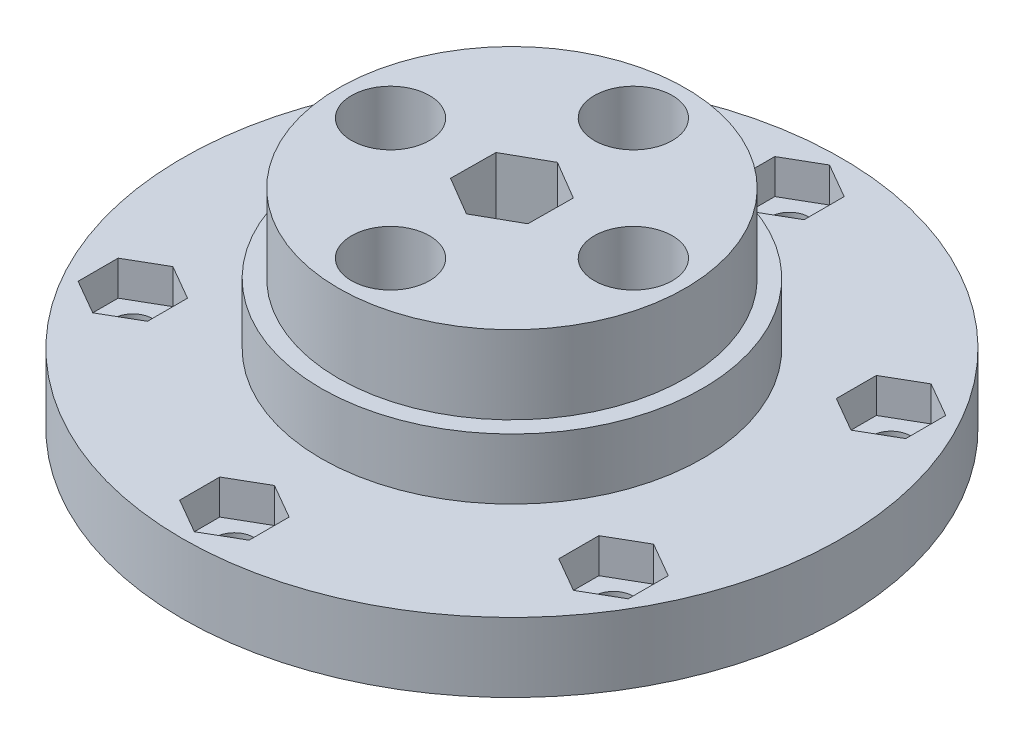
from build123d import *

# Parameters (mm, degrees)
SKETCH_1_R          = 38
EXTRUDE_1_DEPTH     = 8
SKETCH_2_R          = 20
EXTRUDE_2_DEPTH     = 16
SKETCH_7_R          = 22
EXTRUDE_3_DEPTH     = 7
SKETCH_3_R          = 4.5
SKETCH_3_R_2        = 3.25
CUT_EXTRUDE_1_DEPTH = 59.855755878
CUT_EXTRUDE_2_DEPTH = 12
SKETCH_5_R          = 2.25
CUT_EXTRUDE_3_DEPTH = 59.855755878
CUT_EXTRUDE_4_DEPTH = 4


with BuildPart() as part:
    # Эскиз1 → Бобышка-Вытянуть1 (new body)
    with BuildSketch(Plane(origin=(0, 0, 0), x_dir=(1, 0, 0), z_dir=(0, 1, 0))):
        Circle(SKETCH_1_R)
    extrude(amount=EXTRUDE_1_DEPTH)

    # Эскиз2 → Бобышка-Вытянуть2 (add)
    with BuildSketch(Plane(origin=(0, 8, 0), x_dir=(1, 0, 0), z_dir=(0, 1, 0))):
        Circle(SKETCH_2_R)
    extrude(amount=EXTRUDE_2_DEPTH)

    # Эскиз7 → Бобышка-Вытянуть3 (add)
    with BuildSketch(Plane(origin=(0, 8, 0), x_dir=(1, 0, 0), z_dir=(0, 1, 0))):
        Circle(SKETCH_7_R)
    extrude(amount=EXTRUDE_3_DEPTH)

    # Эскиз3 → Вырез-Вытянуть1 (cut, through all)
    with BuildSketch(Plane(origin=(0, 24, 0), x_dir=(1, 0, 0), z_dir=(0, 1, 0))):
        with Locations((0, 14)):
            Circle(SKETCH_3_R)
        with Locations((14, 0)):
            Circle(SKETCH_3_R)
        with Locations((0, -14)):
            Circle(SKETCH_3_R)
        with Locations((-14, 0)):
            Circle(SKETCH_3_R)
        Circle(SKETCH_3_R_2)
    extrude(amount=-CUT_EXTRUDE_1_DEPTH, mode=Mode.SUBTRACT)

    # Эскиз4 → Вырез-Вытянуть2 (cut)
    with BuildSketch(Plane(origin=(0, 24, 0), x_dir=(1, 0, 0), z_dir=(0, 1, 0))):
        Polygon((4.475641015, -2.639817703), (4.5239697, 2.556109966), (0.048328685, 5.195927669), (-4.475641015, 2.639817703), (-4.5239697, -2.556109966), (-0.048328685, -5.195927669), align=None)
    extrude(amount=-CUT_EXTRUDE_2_DEPTH, mode=Mode.SUBTRACT)

    # Эскиз5 → Вырез-Вытянуть3 (cut, through all)
    with BuildSketch(Plane(origin=(0, 24, 0), x_dir=(1, 0, 0), z_dir=(0, 1, 0))):
        with Locations((0, 32)):
            Circle(SKETCH_5_R)
        with Locations((27.712812921, 16)):
            Circle(SKETCH_5_R)
        with Locations((27.712812921, -16)):
            Circle(SKETCH_5_R)
        with Locations((0, -32)):
            Circle(SKETCH_5_R)
        with Locations((-27.712812921, -16)):
            Circle(SKETCH_5_R)
        with Locations((-27.712812921, 16)):
            Circle(SKETCH_5_R)
    extrude(amount=-CUT_EXTRUDE_3_DEPTH, mode=Mode.SUBTRACT)

    # Эскиз6 → Вырез-Вытянуть4 (cut)
    with BuildSketch(Plane(origin=(0, 8, 0), x_dir=(1, 0, 0), z_dir=(0, 1, 0))):
        Polygon((27.712812921, 11.381197846), (31.712812921, 13.690598923), (31.712812921, 18.309401077), (27.712812921, 20.618802154), (23.712812921, 18.309401077), (23.712812921, 13.690598923), align=None)
        Polygon((4, 29.690598923), (4, 34.309401077), (0, 36.618802154), (-4, 34.309401077), (-4, 29.690598923), (0, 27.381197846), align=None)
        Polygon((23.712812921, -18.309401077), (27.712812921, -20.618802154), (31.712812921, -18.309401077), (31.712812921, -13.690598923), (27.712812921, -11.381197846), (23.712812921, -13.690598923), align=None)
        Polygon((-4, -29.690598923), (-4, -34.309401077), (0, -36.618802154), (4, -34.309401077), (4, -29.690598923), (0, -27.381197846), align=None)
        Polygon((-27.712812921, -11.381197846), (-31.712812921, -13.690598923), (-31.712812921, -18.309401077), (-27.712812921, -20.618802154), (-23.712812921, -18.309401077), (-23.712812921, -13.690598923), align=None)
        Polygon((-23.712812921, 18.309401077), (-27.712812921, 20.618802154), (-31.712812921, 18.309401077), (-31.712812921, 13.690598923), (-27.712812921, 11.381197846), (-23.712812921, 13.690598923), align=None)
    extrude(amount=-CUT_EXTRUDE_4_DEPTH, mode=Mode.SUBTRACT)


solid = part.part
